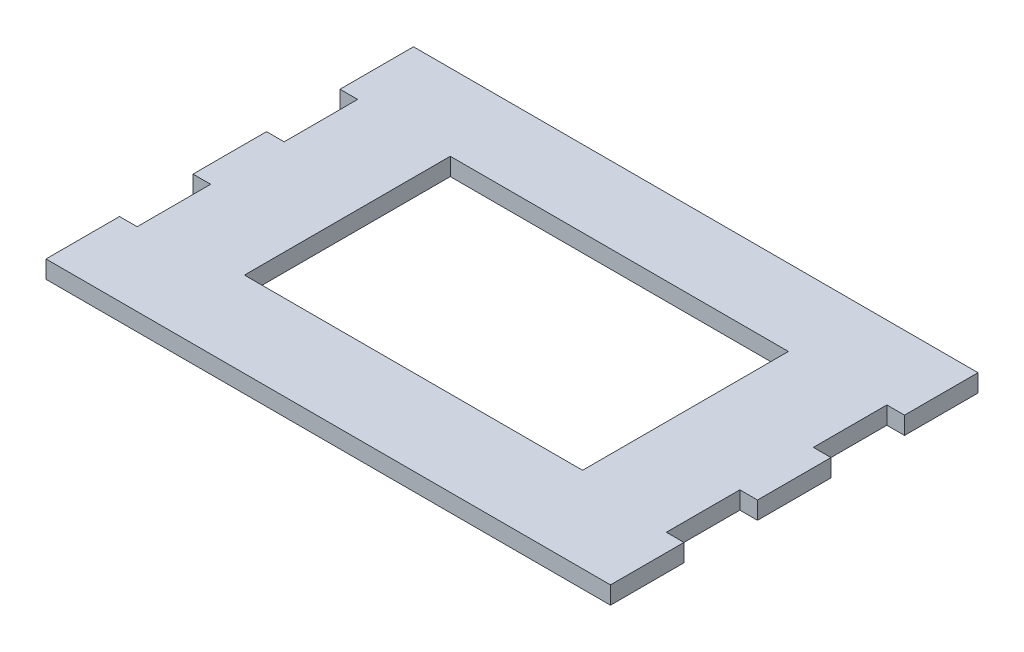
from build123d import *

# Parameters (mm, degrees)
SKETCH3_W           = 192
SKETCH3_H           = 125
BOSS_EXTRUDE1_DEPTH = 6
CUT_EXTRUDE1_DEPTH  = 6
SKETCH9_W           = 115
SKETCH9_H           = 70
CUT_EXTRUDE2_DEPTH  = 47


with BuildPart() as part:
    # Sketch3 → Boss-Extrude1 (new body)
    with BuildSketch(Plane(origin=(0, 0, 0), x_dir=(1, 0, 0), z_dir=(0, 1, 0))):
        with Locations((90, 51.5)):
            Rectangle(SKETCH3_W, SKETCH3_H)
    extrude(amount=BOSS_EXTRUDE1_DEPTH)

    # Sketch4 → Cut-Extrude1 (cut)
    with BuildSketch(Plane(origin=(0, 0, 0), x_dir=(1, 0, 0), z_dir=(0, 1, 0))):
        Polygon((-6, 114), (-6, 89), (0, 89), (0, 64), (-6, 64), (-6, 39), (0, 39), (0, 14), (-6, 14), (-6, -11), (-10, -11), (-10, 114), align=None)
        Polygon((190, 114), (186, 114), (186, 89), (180, 89), (180, 64), (186, 64), (186, 39), (180, 39), (180, 14), (186, 14), (186, -11), (190, -11), align=None)
    extrude(amount=CUT_EXTRUDE1_DEPTH, mode=Mode.SUBTRACT)

    # Sketch9 → Cut-Extrude2 (cut)
    with BuildSketch(Plane(origin=(0, 0, 0), x_dir=(1, 0, 0), z_dir=(0, 1, 0))):
        with Locations((90, 53)):
            Rectangle(SKETCH9_W, SKETCH9_H)
    extrude(amount=CUT_EXTRUDE2_DEPTH, mode=Mode.SUBTRACT)


solid = part.part
